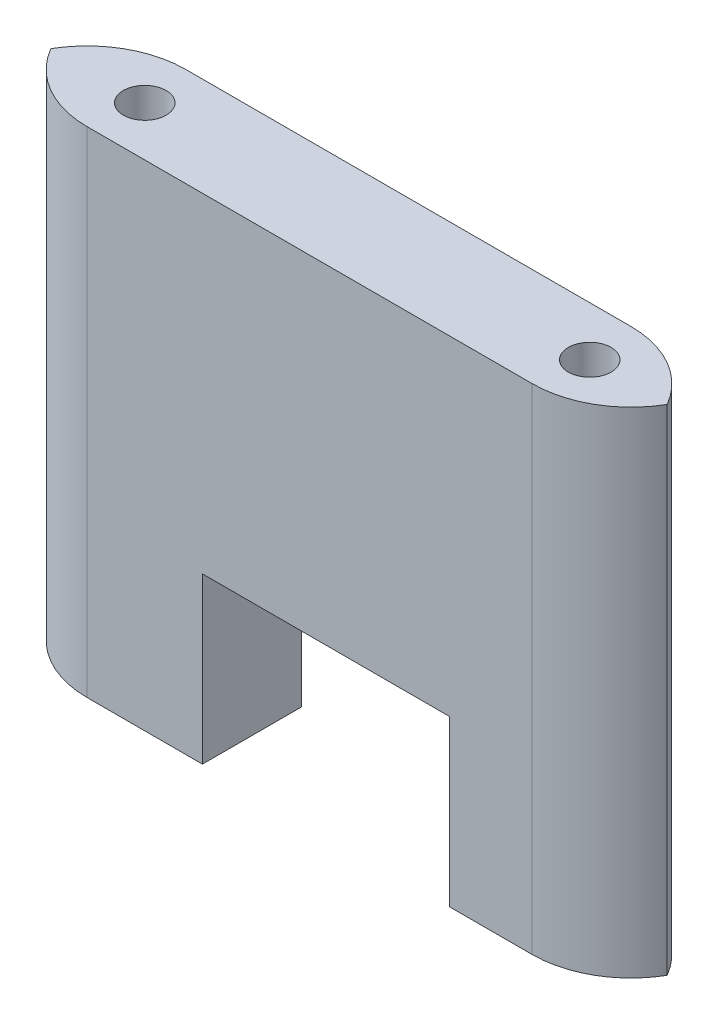
from build123d import *

# Parameters (mm, degrees)
SKETCH3_W           = 49.53
SKETCH3_H           = 38.1
BOSS_EXTRUDE2_DEPTH = 7.62
SKETCH4_W           = 19.05
SKETCH4_H           = 12.7
CUT_EXTRUDE1_DEPTH  = 63.951531355
SKETCH6_R           = 1.651
CUT_EXTRUDE2_DEPTH  = 5.08
CUT_EXTRUDE3_START  = -5.08
SKETCH8_R           = 1.651
CUT_EXTRUDE3_DEPTH  = 5.08
FILLET3_R           = 7.62


with BuildPart() as part:
    # Sketch3 → Boss-Extrude2 (new body)
    with BuildSketch(Plane.XY):
        with Locations((24.765, 19.05)):
            Rectangle(SKETCH3_W, SKETCH3_H)
    extrude(amount=BOSS_EXTRUDE2_DEPTH)

    # Sketch4 → Cut-Extrude1 (cut, through all)
    with BuildSketch(Plane.XY.offset(7.62)):
        with Locations((26.035, 6.35)):
            Rectangle(SKETCH4_W, SKETCH4_H)
    extrude(amount=-CUT_EXTRUDE1_DEPTH, mode=Mode.SUBTRACT)

    # Sketch6 → Cut-Extrude2 (cut)
    with BuildSketch(Plane.XZ):
        with Locations(Location((8.255, 3.81, 0), (0, 0, 270))):
            Circle(SKETCH6_R)
        with Locations(Location((42.545, 3.81, 0), (0, 0, 270))):
            Circle(SKETCH6_R)
    extrude(amount=-CUT_EXTRUDE2_DEPTH, mode=Mode.SUBTRACT)

    # Sketch8 → Cut-Extrude3 (cut)
    with BuildSketch(Plane(origin=(0, 38.1, 0), x_dir=(1, 0, 0), z_dir=(0, 1, 0)).offset(CUT_EXTRUDE3_START)):
        with Locations(Location((8.255, -3.81, 0), (0, 0, 90))):
            Circle(SKETCH8_R)
        with Locations(Location((42.545, -3.81, 0), (0, 0, 90))):
            Circle(SKETCH8_R)
    extrude(amount=CUT_EXTRUDE3_DEPTH, mode=Mode.SUBTRACT)

    # Fillet3
    # the kernel refuses this fillet: 7.62 mm, written as the material it takes off along each edge
    with BuildSketch(Plane(origin=(49.53, -19.05, 7.62), x_dir=(-1, 0, 0), z_dir=(0, 1, 0))) as fillet3_piece_1:
        with BuildLine():
            CenterArc((FILLET3_R, -FILLET3_R), FILLET3_R, 90, 90)
            Line((0, -FILLET3_R), (0, 0))
            Line((0, 0), (FILLET3_R, 0))
        make_face()
    extrude(amount=76.2, mode=Mode.SUBTRACT)
    with BuildSketch(Plane(origin=(49.53, -19.05, 0), x_dir=(-1, 0, 0), z_dir=(0, 1, 0)), Plane(origin=(0, 57.15, 0), x_dir=(1, 0, 0), z_dir=(0, -1, 0)), Plane(origin=(0, 57.15, 7.62), x_dir=(0, 0, -1), z_dir=(0, -1, 0))) as fillet3_piece_2:
        with BuildLine():
            CenterArc((FILLET3_R, FILLET3_R), FILLET3_R, 180, 90)
            Line((0, FILLET3_R), (0, 0))
            Line((0, 0), (FILLET3_R, 0))
        make_face()
    extrude(amount=76.2, mode=Mode.SUBTRACT)


solid = part.part
